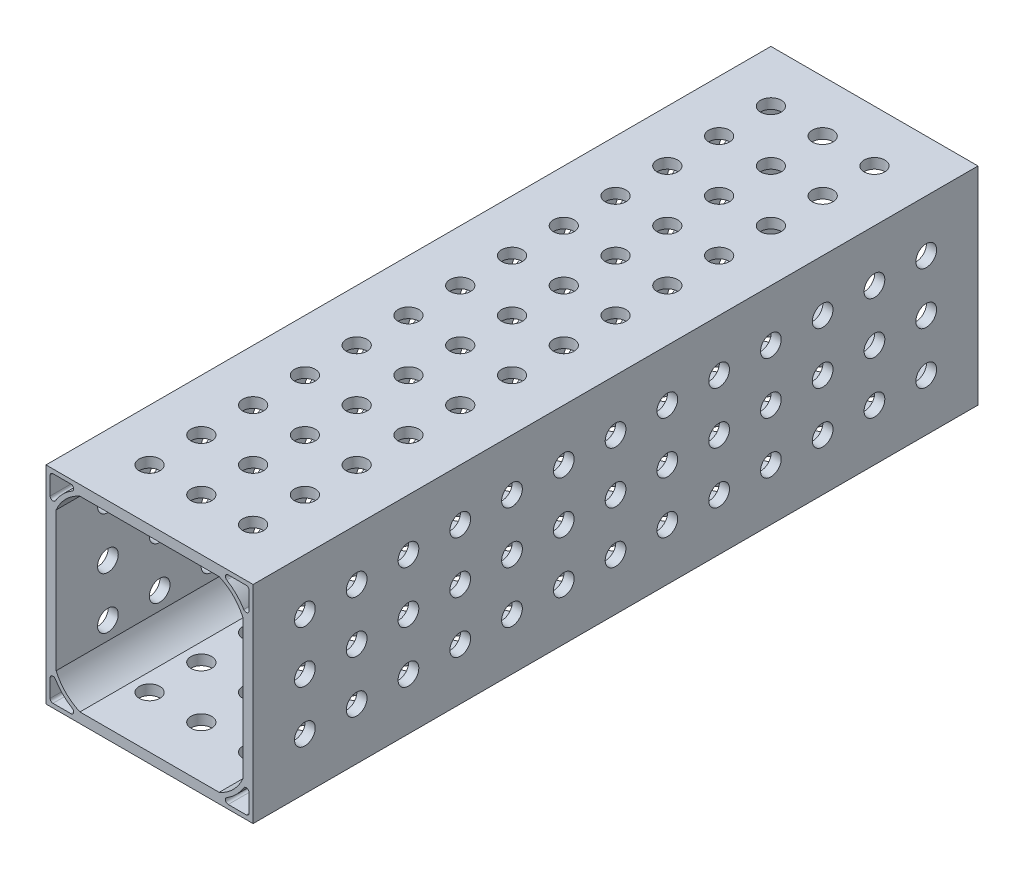
from build123d import *

# Parameters (mm, degrees)
SKETCH1_W                                = 50.8
SKETCH1_H                                = 50.8
BOSS_EXTRUDE1_DEPTH                      = 88.9
CUT_EXTRUDE1_DEPTH                       = 182.392282085
MIRROR1_AT_THE_SECOND_PLANE_COPY_1_DEPTH = 182.392282085
SKETCH4_R                                = 2.54
CUT_EXTRUDE2_DEPTH                       = 106.494123059
LPATTERN1_COUNT                          = 13
LPATTERN1_PITCH                          = 12.7
LPATTERN1_COUNT_DIR2                     = 3
LPATTERN1_PITCH_DIR2                     = 12.7
MIRROR2_COPY_1_SKETCH_R                  = 2.54
MIRROR2_COPY_1_DEPTH                     = 106.494123059
MIRROR2_COPY_2_SKETCH_R                  = 2.54
MIRROR2_COPY_2_DEPTH                     = 106.494123059
MIRROR2_COPY_3_SKETCH_R                  = 2.54
MIRROR2_COPY_3_DEPTH                     = 106.494123059
MIRROR2_COPY_4_SKETCH_R                  = 2.54
MIRROR2_COPY_4_DEPTH                     = 106.494123059
MIRROR2_COPY_5_SKETCH_R                  = 2.54
MIRROR2_COPY_5_DEPTH                     = 106.494123059
MIRROR2_COPY_6_SKETCH_R                  = 2.54
MIRROR2_COPY_6_DEPTH                     = 106.494123059
MIRROR2_COPY_7_SKETCH_R                  = 2.54
MIRROR2_COPY_7_DEPTH                     = 106.494123059
MIRROR2_COPY_8_SKETCH_R                  = 2.54
MIRROR2_COPY_8_DEPTH                     = 106.494123059
MIRROR2_COPY_9_SKETCH_R                  = 2.54
MIRROR2_COPY_9_DEPTH                     = 106.494123059
MIRROR2_COPY_10_SKETCH_R                 = 2.54
MIRROR2_COPY_10_DEPTH                    = 106.494123059
MIRROR2_COPY_11_SKETCH_R                 = 2.54
MIRROR2_COPY_11_DEPTH                    = 106.494123059
MIRROR2_COPY_12_SKETCH_R                 = 2.54
MIRROR2_COPY_12_DEPTH                    = 106.494123059
MIRROR2_COPY_13_SKETCH_R                 = 2.54
MIRROR2_COPY_13_DEPTH                    = 106.494123059
MIRROR2_COPY_14_SKETCH_R                 = 2.54
MIRROR2_COPY_14_DEPTH                    = 106.494123059
MIRROR2_COPY_15_SKETCH_R                 = 2.54
MIRROR2_COPY_15_DEPTH                    = 106.494123059
MIRROR2_COPY_16_SKETCH_R                 = 2.54
MIRROR2_COPY_16_DEPTH                    = 106.494123059
MIRROR2_COPY_17_SKETCH_R                 = 2.54
MIRROR2_COPY_17_DEPTH                    = 106.494123059
MIRROR2_COPY_18_SKETCH_R                 = 2.54
MIRROR2_COPY_18_DEPTH                    = 106.494123059
MIRROR2_COPY_19_SKETCH_R                 = 2.54
MIRROR2_COPY_19_DEPTH                    = 106.494123059
MIRROR2_COPY_20_SKETCH_R                 = 2.54
MIRROR2_COPY_20_DEPTH                    = 106.494123059
MIRROR2_COPY_21_SKETCH_R                 = 2.54
MIRROR2_COPY_21_DEPTH                    = 106.494123059
MIRROR2_COPY_22_SKETCH_R                 = 2.54
MIRROR2_COPY_22_DEPTH                    = 106.494123059
MIRROR2_COPY_23_SKETCH_R                 = 2.54
MIRROR2_COPY_23_DEPTH                    = 106.494123059
MIRROR2_COPY_24_SKETCH_R                 = 2.54
MIRROR2_COPY_24_DEPTH                    = 106.494123059
MIRROR2_COPY_25_SKETCH_R                 = 2.54
MIRROR2_COPY_25_DEPTH                    = 106.494123059
MIRROR2_COPY_26_SKETCH_R                 = 2.54
MIRROR2_COPY_26_DEPTH                    = 106.494123059
MIRROR2_COPY_27_SKETCH_R                 = 2.54
MIRROR2_COPY_27_DEPTH                    = 106.494123059
MIRROR2_COPY_28_SKETCH_R                 = 2.54
MIRROR2_COPY_28_DEPTH                    = 106.494123059
MIRROR2_COPY_29_SKETCH_R                 = 2.54
MIRROR2_COPY_29_DEPTH                    = 106.494123059
MIRROR2_COPY_30_SKETCH_R                 = 2.54
MIRROR2_COPY_30_DEPTH                    = 106.494123059
MIRROR2_COPY_31_SKETCH_R                 = 2.54
MIRROR2_COPY_31_DEPTH                    = 106.494123059
MIRROR2_COPY_32_SKETCH_R                 = 2.54
MIRROR2_COPY_32_DEPTH                    = 106.494123059
MIRROR2_COPY_33_SKETCH_R                 = 2.54
MIRROR2_COPY_33_DEPTH                    = 106.494123059
MIRROR2_COPY_34_SKETCH_R                 = 2.54
MIRROR2_COPY_34_DEPTH                    = 106.494123059
MIRROR2_COPY_35_SKETCH_R                 = 2.54
MIRROR2_COPY_35_DEPTH                    = 106.494123059
MIRROR2_COPY_36_SKETCH_R                 = 2.54
MIRROR2_COPY_36_DEPTH                    = 106.494123059
MIRROR2_COPY_37_SKETCH_R                 = 2.54
MIRROR2_COPY_37_DEPTH                    = 106.494123059
MIRROR2_COPY_38_SKETCH_R                 = 2.54
MIRROR2_COPY_38_DEPTH                    = 106.494123059
MIRROR2_COPY_39_SKETCH_R                 = 2.54
MIRROR2_COPY_39_DEPTH                    = 106.494123059


with BuildPart() as part:
    # Sketch1 → Boss-Extrude1 (new, symmetric)
    with BuildSketch(Plane.XY):
        Rectangle(SKETCH1_W, SKETCH1_H)
    extrude(amount=BOSS_EXTRUDE1_DEPTH, both=True)

    # Sketch2 → Cut-Extrude1 (cut, through all)
    with BuildSketch(Plane.XY.offset(88.9)):
        with BuildLine():
            Line((0, 0), (0, 22.914082254))
            Line((0, 22.914082254), (-17.077234966, 22.914082254))
            ThreePointArc((-17.077234966, 22.914082254), (-20.557724311, 20.557724311), (-22.914082254, 17.077234966))
            Line((-22.914082254, 17.077234966), (-22.914082254, 0))
            Line((-22.914082254, 0), (0, 0))
        make_face()
        with BuildLine():
            Line((-24.384, 23.692411086), (-24.384, 19.297089168))
            ThreePointArc((-24.384, 19.297089168), (-23.877056001, 18.630604749), (-23.099417578, 18.941204461))
            ThreePointArc((-23.099417578, 18.941204461), (-21.276144801, 21.276144801), (-18.941204461, 23.099417578))
            ThreePointArc((-18.941204461, 23.099417578), (-18.695249844, 23.351699105), (-18.605500254, 23.692411086))
            ThreePointArc((-18.605500254, 23.692411086), (-18.808061957, 24.181438297), (-19.297089168, 24.384))
            Line((-19.297089168, 24.384), (-23.692411086, 24.384))
            ThreePointArc((-23.692411086, 24.384), (-24.181438297, 24.181438297), (-24.384, 23.692411086))
        make_face()
    cut_extrude1 = extrude(amount=-CUT_EXTRUDE1_DEPTH, mode=Mode.SUBTRACT)

    # Mirror1: Cut-Extrude1 across plane
    add(cut_extrude1.mirror(Plane(origin=(0, 0, 0), x_dir=(0, 0, 1), z_dir=(1, 0, 0))), mode=Mode.SUBTRACT)

    # Mirror1 at the second plane: Cut-Extrude1 across plane
    add(cut_extrude1.mirror(Plane.ZX), mode=Mode.SUBTRACT)

    # Mirror1 at the second plane copy 1 sketc → Mirror1 at the second plane copy 1 (cut, through all)
    with BuildSketch(Plane(origin=(0, 0, 88.9), x_dir=(-1, 0, 0), z_dir=(0, 0, 1))):
        with BuildLine():
            Line((0, 0), (0, 22.914082254))
            Line((0, 22.914082254), (-17.077234966, 22.914082254))
            ThreePointArc((-17.077234966, 22.914082254), (-20.557724311, 20.557724311), (-22.914082254, 17.077234966))
            Line((-22.914082254, 17.077234966), (-22.914082254, 0))
            Line((-22.914082254, 0), (0, 0))
        make_face()
        with BuildLine():
            Line((-24.384, 23.692411086), (-24.384, 19.297089168))
            ThreePointArc((-24.384, 19.297089168), (-23.877056001, 18.630604749), (-23.099417578, 18.941204461))
            ThreePointArc((-23.099417578, 18.941204461), (-21.276144801, 21.276144801), (-18.941204461, 23.099417578))
            ThreePointArc((-18.941204461, 23.099417578), (-18.695249844, 23.351699105), (-18.605500254, 23.692411086))
            ThreePointArc((-18.605500254, 23.692411086), (-18.808061957, 24.181438297), (-19.297089168, 24.384))
            Line((-19.297089168, 24.384), (-23.692411086, 24.384))
            ThreePointArc((-23.692411086, 24.384), (-24.181438297, 24.181438297), (-24.384, 23.692411086))
        make_face()
    extrude(amount=-MIRROR1_AT_THE_SECOND_PLANE_COPY_1_DEPTH, mode=Mode.SUBTRACT)

    # Sketch4 → Cut-Extrude2 (cut, through all)
    with BuildSketch(Plane(origin=(0, 25.4, 0), x_dir=(1, 0, 0), z_dir=(0, 1, 0))):
        with Locations((-12.7, -76.2)):
            Circle(SKETCH4_R)
    cut_extrude2 = extrude(amount=-CUT_EXTRUDE2_DEPTH, mode=Mode.SUBTRACT)

    # LPattern1: Cut-Extrude2 13 × 3
    with Locations(*[(j * LPATTERN1_PITCH_DIR2, 0, -i * LPATTERN1_PITCH) for i in range(LPATTERN1_COUNT) for j in range(LPATTERN1_COUNT_DIR2) if (i, j) != (0, 0)]):
        add(cut_extrude2, mode=Mode.SUBTRACT)

    # Mirror2 copy 1 sketch → Mirror2 copy 1 (cut, through all)
    with BuildSketch(Plane(origin=(25.4, 12.7, 0), x_dir=(0, 1, 0), z_dir=(1, 0, 0))):
        with Locations((-12.7, 76.2)):
            Circle(MIRROR2_COPY_1_SKETCH_R)
    extrude(amount=-MIRROR2_COPY_1_DEPTH, mode=Mode.SUBTRACT)

    # Mirror2 copy 2 sketch → Mirror2 copy 2 (cut, through all)
    with BuildSketch(Plane(origin=(25.4, 25.4, 0), x_dir=(0, 1, 0), z_dir=(1, 0, 0))):
        with Locations((-12.7, 76.2)):
            Circle(MIRROR2_COPY_2_SKETCH_R)
    extrude(amount=-MIRROR2_COPY_2_DEPTH, mode=Mode.SUBTRACT)

    # Mirror2 copy 3 sketch → Mirror2 copy 3 (cut, through all)
    with BuildSketch(Plane(origin=(25.4, 0, -12.7), x_dir=(0, 1, 0), z_dir=(1, 0, 0))):
        with Locations((-12.7, 76.2)):
            Circle(MIRROR2_COPY_3_SKETCH_R)
    extrude(amount=-MIRROR2_COPY_3_DEPTH, mode=Mode.SUBTRACT)

    # Mirror2 copy 4 sketch → Mirror2 copy 4 (cut, through all)
    with BuildSketch(Plane(origin=(25.4, 12.7, -12.7), x_dir=(0, 1, 0), z_dir=(1, 0, 0))):
        with Locations((-12.7, 76.2)):
            Circle(MIRROR2_COPY_4_SKETCH_R)
    extrude(amount=-MIRROR2_COPY_4_DEPTH, mode=Mode.SUBTRACT)

    # Mirror2 copy 5 sketch → Mirror2 copy 5 (cut, through all)
    with BuildSketch(Plane(origin=(25.4, 25.4, -12.7), x_dir=(0, 1, 0), z_dir=(1, 0, 0))):
        with Locations((-12.7, 76.2)):
            Circle(MIRROR2_COPY_5_SKETCH_R)
    extrude(amount=-MIRROR2_COPY_5_DEPTH, mode=Mode.SUBTRACT)

    # Mirror2 copy 6 sketch → Mirror2 copy 6 (cut, through all)
    with BuildSketch(Plane(origin=(25.4, 0, -25.4), x_dir=(0, 1, 0), z_dir=(1, 0, 0))):
        with Locations((-12.7, 76.2)):
            Circle(MIRROR2_COPY_6_SKETCH_R)
    extrude(amount=-MIRROR2_COPY_6_DEPTH, mode=Mode.SUBTRACT)

    # Mirror2 copy 7 sketch → Mirror2 copy 7 (cut, through all)
    with BuildSketch(Plane(origin=(25.4, 12.7, -25.4), x_dir=(0, 1, 0), z_dir=(1, 0, 0))):
        with Locations((-12.7, 76.2)):
            Circle(MIRROR2_COPY_7_SKETCH_R)
    extrude(amount=-MIRROR2_COPY_7_DEPTH, mode=Mode.SUBTRACT)

    # Mirror2 copy 8 sketch → Mirror2 copy 8 (cut, through all)
    with BuildSketch(Plane(origin=(25.4, 25.4, -25.4), x_dir=(0, 1, 0), z_dir=(1, 0, 0))):
        with Locations((-12.7, 76.2)):
            Circle(MIRROR2_COPY_8_SKETCH_R)
    extrude(amount=-MIRROR2_COPY_8_DEPTH, mode=Mode.SUBTRACT)

    # Mirror2 copy 9 sketch → Mirror2 copy 9 (cut, through all)
    with BuildSketch(Plane(origin=(25.4, 0, -38.1), x_dir=(0, 1, 0), z_dir=(1, 0, 0))):
        with Locations((-12.7, 76.2)):
            Circle(MIRROR2_COPY_9_SKETCH_R)
    extrude(amount=-MIRROR2_COPY_9_DEPTH, mode=Mode.SUBTRACT)

    # Mirror2 copy 10 sketch → Mirror2 copy 10 (cut, through all)
    with BuildSketch(Plane(origin=(25.4, 12.7, -38.1), x_dir=(0, 1, 0), z_dir=(1, 0, 0))):
        with Locations((-12.7, 76.2)):
            Circle(MIRROR2_COPY_10_SKETCH_R)
    extrude(amount=-MIRROR2_COPY_10_DEPTH, mode=Mode.SUBTRACT)

    # Mirror2 copy 11 sketch → Mirror2 copy 11 (cut, through all)
    with BuildSketch(Plane(origin=(25.4, 25.4, -38.1), x_dir=(0, 1, 0), z_dir=(1, 0, 0))):
        with Locations((-12.7, 76.2)):
            Circle(MIRROR2_COPY_11_SKETCH_R)
    extrude(amount=-MIRROR2_COPY_11_DEPTH, mode=Mode.SUBTRACT)

    # Mirror2 copy 12 sketch → Mirror2 copy 12 (cut, through all)
    with BuildSketch(Plane(origin=(25.4, 0, -50.8), x_dir=(0, 1, 0), z_dir=(1, 0, 0))):
        with Locations((-12.7, 76.2)):
            Circle(MIRROR2_COPY_12_SKETCH_R)
    extrude(amount=-MIRROR2_COPY_12_DEPTH, mode=Mode.SUBTRACT)

    # Mirror2 copy 13 sketch → Mirror2 copy 13 (cut, through all)
    with BuildSketch(Plane(origin=(25.4, 12.7, -50.8), x_dir=(0, 1, 0), z_dir=(1, 0, 0))):
        with Locations((-12.7, 76.2)):
            Circle(MIRROR2_COPY_13_SKETCH_R)
    extrude(amount=-MIRROR2_COPY_13_DEPTH, mode=Mode.SUBTRACT)

    # Mirror2 copy 14 sketch → Mirror2 copy 14 (cut, through all)
    with BuildSketch(Plane(origin=(25.4, 25.4, -50.8), x_dir=(0, 1, 0), z_dir=(1, 0, 0))):
        with Locations((-12.7, 76.2)):
            Circle(MIRROR2_COPY_14_SKETCH_R)
    extrude(amount=-MIRROR2_COPY_14_DEPTH, mode=Mode.SUBTRACT)

    # Mirror2 copy 15 sketch → Mirror2 copy 15 (cut, through all)
    with BuildSketch(Plane(origin=(25.4, 0, -63.5), x_dir=(0, 1, 0), z_dir=(1, 0, 0))):
        with Locations((-12.7, 76.2)):
            Circle(MIRROR2_COPY_15_SKETCH_R)
    extrude(amount=-MIRROR2_COPY_15_DEPTH, mode=Mode.SUBTRACT)

    # Mirror2 copy 16 sketch → Mirror2 copy 16 (cut, through all)
    with BuildSketch(Plane(origin=(25.4, 12.7, -63.5), x_dir=(0, 1, 0), z_dir=(1, 0, 0))):
        with Locations((-12.7, 76.2)):
            Circle(MIRROR2_COPY_16_SKETCH_R)
    extrude(amount=-MIRROR2_COPY_16_DEPTH, mode=Mode.SUBTRACT)

    # Mirror2 copy 17 sketch → Mirror2 copy 17 (cut, through all)
    with BuildSketch(Plane(origin=(25.4, 25.4, -63.5), x_dir=(0, 1, 0), z_dir=(1, 0, 0))):
        with Locations((-12.7, 76.2)):
            Circle(MIRROR2_COPY_17_SKETCH_R)
    extrude(amount=-MIRROR2_COPY_17_DEPTH, mode=Mode.SUBTRACT)

    # Mirror2 copy 18 sketch → Mirror2 copy 18 (cut, through all)
    with BuildSketch(Plane(origin=(25.4, 0, -76.2), x_dir=(0, 1, 0), z_dir=(1, 0, 0))):
        with Locations((-12.7, 76.2)):
            Circle(MIRROR2_COPY_18_SKETCH_R)
    extrude(amount=-MIRROR2_COPY_18_DEPTH, mode=Mode.SUBTRACT)

    # Mirror2 copy 19 sketch → Mirror2 copy 19 (cut, through all)
    with BuildSketch(Plane(origin=(25.4, 12.7, -76.2), x_dir=(0, 1, 0), z_dir=(1, 0, 0))):
        with Locations((-12.7, 76.2)):
            Circle(MIRROR2_COPY_19_SKETCH_R)
    extrude(amount=-MIRROR2_COPY_19_DEPTH, mode=Mode.SUBTRACT)

    # Mirror2 copy 20 sketch → Mirror2 copy 20 (cut, through all)
    with BuildSketch(Plane(origin=(25.4, 25.4, -76.2), x_dir=(0, 1, 0), z_dir=(1, 0, 0))):
        with Locations((-12.7, 76.2)):
            Circle(MIRROR2_COPY_20_SKETCH_R)
    extrude(amount=-MIRROR2_COPY_20_DEPTH, mode=Mode.SUBTRACT)

    # Mirror2 copy 21 sketch → Mirror2 copy 21 (cut, through all)
    with BuildSketch(Plane(origin=(25.4, 0, -88.9), x_dir=(0, 1, 0), z_dir=(1, 0, 0))):
        with Locations((-12.7, 76.2)):
            Circle(MIRROR2_COPY_21_SKETCH_R)
    extrude(amount=-MIRROR2_COPY_21_DEPTH, mode=Mode.SUBTRACT)

    # Mirror2 copy 22 sketch → Mirror2 copy 22 (cut, through all)
    with BuildSketch(Plane(origin=(25.4, 12.7, -88.9), x_dir=(0, 1, 0), z_dir=(1, 0, 0))):
        with Locations((-12.7, 76.2)):
            Circle(MIRROR2_COPY_22_SKETCH_R)
    extrude(amount=-MIRROR2_COPY_22_DEPTH, mode=Mode.SUBTRACT)

    # Mirror2 copy 23 sketch → Mirror2 copy 23 (cut, through all)
    with BuildSketch(Plane(origin=(25.4, 25.4, -88.9), x_dir=(0, 1, 0), z_dir=(1, 0, 0))):
        with Locations((-12.7, 76.2)):
            Circle(MIRROR2_COPY_23_SKETCH_R)
    extrude(amount=-MIRROR2_COPY_23_DEPTH, mode=Mode.SUBTRACT)

    # Mirror2 copy 24 sketch → Mirror2 copy 24 (cut, through all)
    with BuildSketch(Plane(origin=(25.4, 0, -101.6), x_dir=(0, 1, 0), z_dir=(1, 0, 0))):
        with Locations((-12.7, 76.2)):
            Circle(MIRROR2_COPY_24_SKETCH_R)
    extrude(amount=-MIRROR2_COPY_24_DEPTH, mode=Mode.SUBTRACT)

    # Mirror2 copy 25 sketch → Mirror2 copy 25 (cut, through all)
    with BuildSketch(Plane(origin=(25.4, 12.7, -101.6), x_dir=(0, 1, 0), z_dir=(1, 0, 0))):
        with Locations((-12.7, 76.2)):
            Circle(MIRROR2_COPY_25_SKETCH_R)
    extrude(amount=-MIRROR2_COPY_25_DEPTH, mode=Mode.SUBTRACT)

    # Mirror2 copy 26 sketch → Mirror2 copy 26 (cut, through all)
    with BuildSketch(Plane(origin=(25.4, 25.4, -101.6), x_dir=(0, 1, 0), z_dir=(1, 0, 0))):
        with Locations((-12.7, 76.2)):
            Circle(MIRROR2_COPY_26_SKETCH_R)
    extrude(amount=-MIRROR2_COPY_26_DEPTH, mode=Mode.SUBTRACT)

    # Mirror2 copy 27 sketch → Mirror2 copy 27 (cut, through all)
    with BuildSketch(Plane(origin=(25.4, 0, -114.3), x_dir=(0, 1, 0), z_dir=(1, 0, 0))):
        with Locations((-12.7, 76.2)):
            Circle(MIRROR2_COPY_27_SKETCH_R)
    extrude(amount=-MIRROR2_COPY_27_DEPTH, mode=Mode.SUBTRACT)

    # Mirror2 copy 28 sketch → Mirror2 copy 28 (cut, through all)
    with BuildSketch(Plane(origin=(25.4, 12.7, -114.3), x_dir=(0, 1, 0), z_dir=(1, 0, 0))):
        with Locations((-12.7, 76.2)):
            Circle(MIRROR2_COPY_28_SKETCH_R)
    extrude(amount=-MIRROR2_COPY_28_DEPTH, mode=Mode.SUBTRACT)

    # Mirror2 copy 29 sketch → Mirror2 copy 29 (cut, through all)
    with BuildSketch(Plane(origin=(25.4, 25.4, -114.3), x_dir=(0, 1, 0), z_dir=(1, 0, 0))):
        with Locations((-12.7, 76.2)):
            Circle(MIRROR2_COPY_29_SKETCH_R)
    extrude(amount=-MIRROR2_COPY_29_DEPTH, mode=Mode.SUBTRACT)

    # Mirror2 copy 30 sketch → Mirror2 copy 30 (cut, through all)
    with BuildSketch(Plane(origin=(25.4, 0, -127), x_dir=(0, 1, 0), z_dir=(1, 0, 0))):
        with Locations((-12.7, 76.2)):
            Circle(MIRROR2_COPY_30_SKETCH_R)
    extrude(amount=-MIRROR2_COPY_30_DEPTH, mode=Mode.SUBTRACT)

    # Mirror2 copy 31 sketch → Mirror2 copy 31 (cut, through all)
    with BuildSketch(Plane(origin=(25.4, 12.7, -127), x_dir=(0, 1, 0), z_dir=(1, 0, 0))):
        with Locations((-12.7, 76.2)):
            Circle(MIRROR2_COPY_31_SKETCH_R)
    extrude(amount=-MIRROR2_COPY_31_DEPTH, mode=Mode.SUBTRACT)

    # Mirror2 copy 32 sketch → Mirror2 copy 32 (cut, through all)
    with BuildSketch(Plane(origin=(25.4, 25.4, -127), x_dir=(0, 1, 0), z_dir=(1, 0, 0))):
        with Locations((-12.7, 76.2)):
            Circle(MIRROR2_COPY_32_SKETCH_R)
    extrude(amount=-MIRROR2_COPY_32_DEPTH, mode=Mode.SUBTRACT)

    # Mirror2 copy 33 sketch → Mirror2 copy 33 (cut, through all)
    with BuildSketch(Plane(origin=(25.4, 0, -139.7), x_dir=(0, 1, 0), z_dir=(1, 0, 0))):
        with Locations((-12.7, 76.2)):
            Circle(MIRROR2_COPY_33_SKETCH_R)
    extrude(amount=-MIRROR2_COPY_33_DEPTH, mode=Mode.SUBTRACT)

    # Mirror2 copy 34 sketch → Mirror2 copy 34 (cut, through all)
    with BuildSketch(Plane(origin=(25.4, 12.7, -139.7), x_dir=(0, 1, 0), z_dir=(1, 0, 0))):
        with Locations((-12.7, 76.2)):
            Circle(MIRROR2_COPY_34_SKETCH_R)
    extrude(amount=-MIRROR2_COPY_34_DEPTH, mode=Mode.SUBTRACT)

    # Mirror2 copy 35 sketch → Mirror2 copy 35 (cut, through all)
    with BuildSketch(Plane(origin=(25.4, 25.4, -139.7), x_dir=(0, 1, 0), z_dir=(1, 0, 0))):
        with Locations((-12.7, 76.2)):
            Circle(MIRROR2_COPY_35_SKETCH_R)
    extrude(amount=-MIRROR2_COPY_35_DEPTH, mode=Mode.SUBTRACT)

    # Mirror2 copy 36 sketch → Mirror2 copy 36 (cut, through all)
    with BuildSketch(Plane(origin=(25.4, 0, -152.4), x_dir=(0, 1, 0), z_dir=(1, 0, 0))):
        with Locations((-12.7, 76.2)):
            Circle(MIRROR2_COPY_36_SKETCH_R)
    extrude(amount=-MIRROR2_COPY_36_DEPTH, mode=Mode.SUBTRACT)

    # Mirror2 copy 37 sketch → Mirror2 copy 37 (cut, through all)
    with BuildSketch(Plane(origin=(25.4, 12.7, -152.4), x_dir=(0, 1, 0), z_dir=(1, 0, 0))):
        with Locations((-12.7, 76.2)):
            Circle(MIRROR2_COPY_37_SKETCH_R)
    extrude(amount=-MIRROR2_COPY_37_DEPTH, mode=Mode.SUBTRACT)

    # Mirror2 copy 38 sketch → Mirror2 copy 38 (cut, through all)
    with BuildSketch(Plane(origin=(25.4, 25.4, -152.4), x_dir=(0, 1, 0), z_dir=(1, 0, 0))):
        with Locations((-12.7, 76.2)):
            Circle(MIRROR2_COPY_38_SKETCH_R)
    extrude(amount=-MIRROR2_COPY_38_DEPTH, mode=Mode.SUBTRACT)

    # Mirror2 copy 39 sketch → Mirror2 copy 39 (cut, through all)
    with BuildSketch(Plane.YZ.offset(25.4)):
        with Locations((-12.7, 76.2)):
            Circle(MIRROR2_COPY_39_SKETCH_R)
    extrude(amount=-MIRROR2_COPY_39_DEPTH, mode=Mode.SUBTRACT)


solid = part.part
